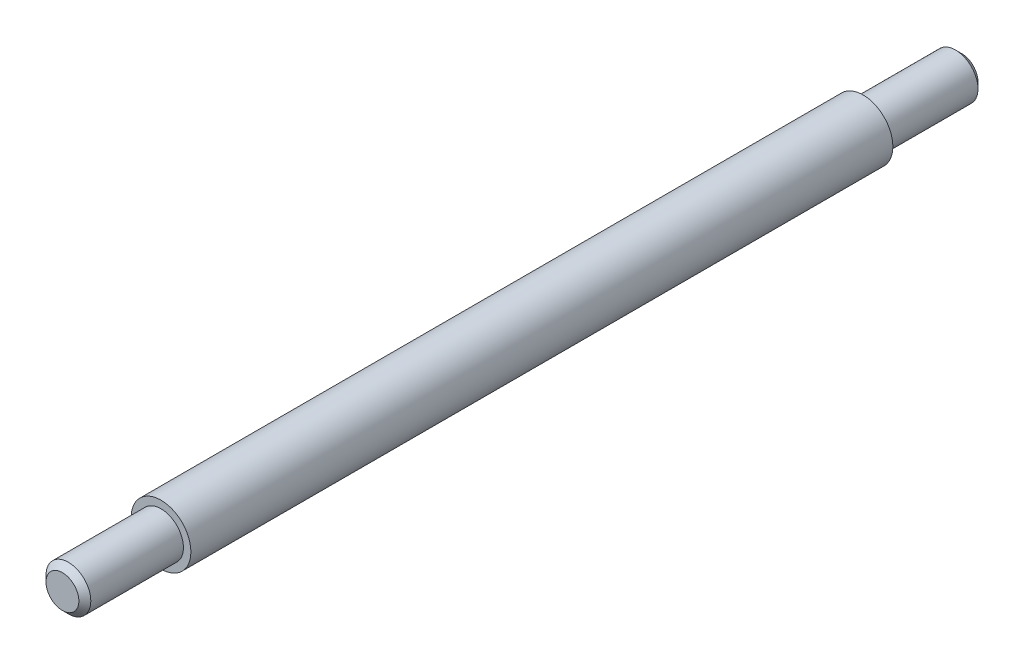
from build123d import *

# Parameters (mm, degrees)
SKETCH1_R           = 2
BOSS_EXTRUDE1_DEPTH = 47
SKETCH2_R           = 1.5
BOSS_EXTRUDE2_DEPTH = 6.6
BOSS_EXTRUDE3_START = 6.6
SKETCH3_R           = 1.5
BOSS_EXTRUDE3_DEPTH = 6.6
CHAMFER1_SIZE       = 0.4


with BuildPart() as part:
    # Sketch1 → Boss-Extrude1 (new body)
    with BuildSketch(Plane.XY):
        Circle(SKETCH1_R)
    extrude(amount=-BOSS_EXTRUDE1_DEPTH)

    # Sketch2 → Boss-Extrude2 (add)
    with BuildSketch(Plane.XY):
        Circle(SKETCH2_R)
    extrude(amount=BOSS_EXTRUDE2_DEPTH)

    # Sketch3 → Boss-Extrude3 (add)
    with BuildSketch(Plane(origin=(0, 0, -47), x_dir=(-1, 0, 0), z_dir=(0, 0, -1)).offset(BOSS_EXTRUDE3_START)):
        Circle(SKETCH3_R)
    extrude(amount=-BOSS_EXTRUDE3_DEPTH)

    # Chamfer1
    chamfer1_edges = [part.edges().sort_by_distance(p)[0] for p in [
        (-1.5, 0, 6.6),
        (1.5, 0, -53.6),
    ]]
    chamfer(chamfer1_edges, length=CHAMFER1_SIZE)


solid = part.part
